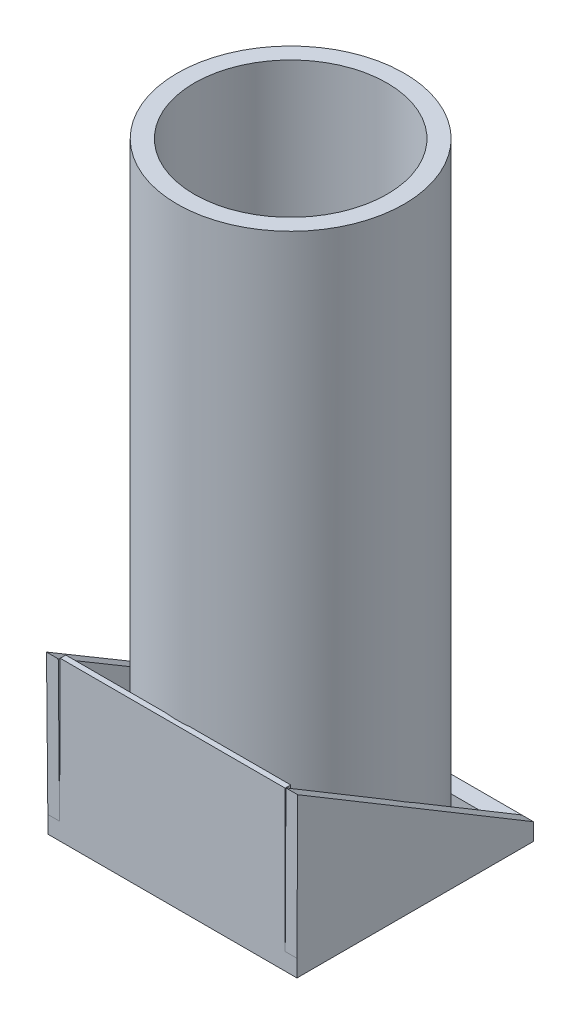
from build123d import *

# Parameters (mm, degrees)
SKETCH1_R           = 135
BOSS_EXTRUDE1_DEPTH = 700
SKETCH2_W           = 296.361167152
SKETCH2_H           = 281.411070578
BOSS_EXTRUDE2_DEPTH = 20.32
SHELL1_T            = -20.32
SHELL2_START        = -20.32
SHELL2_DEPTH        = 20.32
BOSS_EXTRUDE3_DEPTH = 13.97
BOSS_EXTRUDE4_DEPTH = 13.97
BOSS_EXTRUDE5_DEPTH = 6.604


# Read off the part's stored shape, not the designer's step: Shell2
with BuildPart() as part:
    # Sketch1 → Boss-Extrude1 (new body)
    with BuildSketch(Plane(origin=(0, 0, 0), x_dir=(1, 0, 0), z_dir=(0, 1, 0))):
        with Locations(Location((0, 0, 0), (0, 0, 270))):
            Circle(SKETCH1_R)
    extrude(amount=BOSS_EXTRUDE1_DEPTH)

    # Sketch2 → Boss-Extrude2 (add)
    with BuildSketch(Plane(origin=(0, 0, 0), x_dir=(-1, 0, 0), z_dir=(0, -1, 0))):
        Rectangle(SKETCH2_W, SKETCH2_H)
    extrude(amount=BOSS_EXTRUDE2_DEPTH)

    # Shell1
    shell1_openings = [part.faces().sort_by_distance(p)[0] for p in [
        (0, 700, 0),
    ]]
    offset(amount=SHELL1_T, openings=shell1_openings, kind=Kind.INTERSECTION)

    # Shell2 outline → Shell2 (cut)
    with BuildSketch(Plane(origin=(0, 0, 0), x_dir=(1, 0, 0), z_dir=(0, 1, 0)).offset(SHELL2_START)):
        with BuildLine():
            Line((-127.860583576, -43.320562873), (-127.860583576, -120.385535289))
            Line((-127.860583576, -120.385535289), (-61.092740103, -120.385535289))
            ThreePointArc((-61.092740103, -120.385535289), (-102.032309224, -88.399139557), (-127.860583576, -43.320562873))
        make_face()
        with BuildLine():
            Line((-127.860583576, 120.385535289), (-127.860583576, 43.320562873))
            ThreePointArc((-127.860583576, 43.320562873), (-102.032309224, 88.399139557), (-61.092740103, 120.385535289))
            Line((-61.092740103, 120.385535289), (-127.860583576, 120.385535289))
        make_face()
        with BuildLine():
            ThreePointArc((127.860583576, -43.320562873), (102.032309224, -88.399139557), (61.092740103, -120.385535289))
            Line((61.092740103, -120.385535289), (127.860583576, -120.385535289))
            Line((127.860583576, -120.385535289), (127.860583576, -43.320562873))
        make_face()
        with BuildLine():
            Line((127.860583576, 120.385535289), (61.092740103, 120.385535289))
            ThreePointArc((61.092740103, 120.385535289), (102.032309224, 88.399139557), (127.860583576, 43.320562873))
            Line((127.860583576, 43.320562873), (127.860583576, 120.385535289))
        make_face()
    extrude(amount=SHELL2_DEPTH, mode=Mode.SUBTRACT)

    # Sketch3 → Boss-Extrude3 (add)
    with BuildSketch(Plane.ZY.offset(148.180583576)):
        Polygon((-140.705535289, 0), (142.300478433, 168.1079442), (140.705535289, 0), align=None)
    extrude(amount=-BOSS_EXTRUDE3_DEPTH)

    # Sketch4 → Boss-Extrude4 (add)
    with BuildSketch(Plane(origin=(148.180583576, 0, 0), x_dir=(0, 0, -1), z_dir=(1, 0, 0))):
        Polygon((140.705535289, 0), (-139.866409205, 168.107944167), (-140.705535289, 0), align=None)
    extrude(amount=-BOSS_EXTRUDE4_DEPTH)

    # Sketch6 → Boss-Extrude5 (add)
    with BuildSketch(Plane.XY.offset(140.705535289)):
        Polygon((134.162146303, 168.27987687), (-133.500855759, 168.27987687), (-134.210583576, 0), (134.210583576, 0), align=None)
    extrude(amount=-BOSS_EXTRUDE5_DEPTH)


solid = part.part
